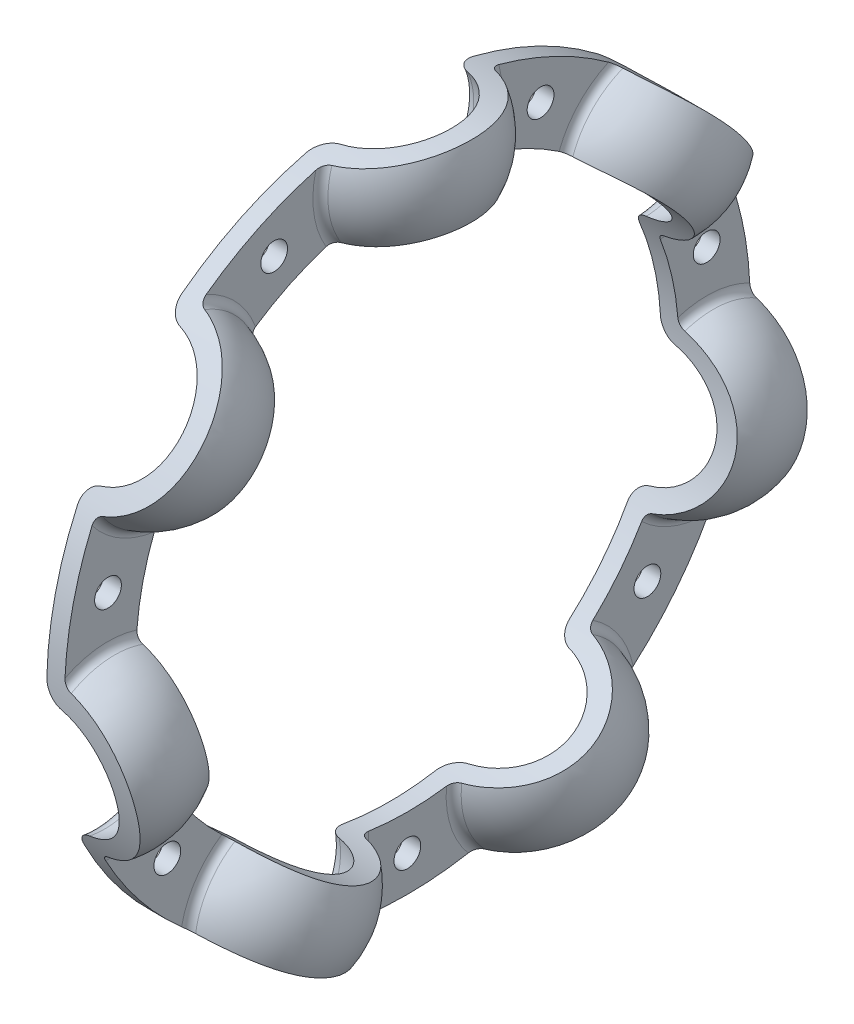
from build123d import *
from build123d.topology import SkipClean

# Parameters (mm, degrees)
SKETCH1_R                = 25
BOSS_EXTRUDE1_DEPTH      = 1
REVOLVE1_ANGLE           = 180
CUT_REVOLVE1_ANGLE       = 180
FILLET1_R                = 0.5
FILLET2_R                = 1
CIRPATTERN1_COUNT        = 7
FILLET1_OF_CIRPATTERN1_R = 0.5
FILLET2_OF_CIRPATTERN1_R = 1
CUT_EXTRUDE1_DEPTH       = 36.58089389
CUT_EXTRUDE1_DEPTH_BACK  = 36.58089389
SKETCH4_R                = 25
SKETCH4_R_2              = 19.2
CUT_EXTRUDE2_DEPTH       = 28.445947018
CUT_EXTRUDE2_DEPTH_BACK  = 28.445947018
SKETCH5_R                = 15.2
SKETCH6_R                = 0.75
CUT_EXTRUDE3_DEPTH       = 1
CIRPATTERN2_COUNT        = 7


with BuildPart() as part:
    # Sketch1 → Boss-Extrude1 (new body)
    with BuildSketch(Plane(origin=(0, 0, 0), x_dir=(0, 0, -1), z_dir=(1, 0, 0))):
        Circle(SKETCH1_R)
    extrude(amount=BOSS_EXTRUDE1_DEPTH)

    # Sketch2 → Revolve1 (revolve)
    with BuildSketch(Plane.ZY):
        with BuildLine():
            Line((-5, 17.2), (5, 17.2))
            ThreePointArc((5, 17.2), (0, 12.2), (-5, 17.2))
        make_face()
    revolve1 = revolve(axis=Axis((0, 17.2, -5), (0, 0, 1)), revolution_arc=REVOLVE1_ANGLE)

    # Sketch3 → Cut-Revolve1 (revolve, cut)
    with BuildSketch(Plane.ZY):
        with BuildLine():
            Line((-4, 17.2), (4, 17.2))
            ThreePointArc((4, 17.2), (0, 21.2), (-4, 17.2))
        make_face()
    cut_revolve1 = revolve(axis=Axis((0, 17.2, -4), (0, 0, -1)), revolution_arc=CUT_REVOLVE1_ANGLE, mode=Mode.SUBTRACT)

    # Fillet1
    fillet1_edges = [part.edges().sort_by_distance(p)[0] for p in [
        (1, 17.2, -4.898979486),
    ]]
    fillet(fillet1_edges, radius=FILLET1_R)

    # Fillet2
    fillet2_edges = [part.edges().sort_by_distance(p)[0] for p in [
        (0, 13.2, 0),
    ]]
    fillet(fillet2_edges, radius=FILLET2_R)

    # CirPattern1: Revolve1, Cut-Revolve1 ×7 about axis
    cirpattern1_axis = Axis((1, 0, 0), (1, 0, 0))
    add([revolve1.rotate(cirpattern1_axis, i * 360 / CIRPATTERN1_COUNT) for i in range(1, CIRPATTERN1_COUNT)])
    add([cut_revolve1.rotate(cirpattern1_axis, i * 360 / CIRPATTERN1_COUNT) for i in range(1, CIRPATTERN1_COUNT)], mode=Mode.SUBTRACT)

    # Fillet1 of CirPattern1
    fillet1_of_cirpattern1_edges = [part.edges().sort_by_distance(p)[0] for p in [
        (1, 14.554200986, 10.39303775),
        (1, 0.948791778, 17.85888558),
        (1, -13.371076991, 11.876628314),
        (1, -17.622252065, -3.048972312),
        (1, -8.603511906, -15.678634599),
        (1, 6.893848198, -16.501965247),
    ]]
    fillet(fillet1_of_cirpattern1_edges, radius=FILLET1_OF_CIRPATTERN1_R)

    # Fillet2 of CirPattern1
    fillet2_of_cirpattern1_edges = [part.edges().sort_by_distance(p)[0] for p in [
        (0, 8.230065385, 10.320175569),
        (0, -2.937276328, 12.869048441),
        (0, -11.892789056, 5.727265356),
        (0, -11.892789056, -5.727265356),
        (0, -2.937276328, -12.869048441),
        (0, 8.230065385, -10.320175569),
    ]]
    fillet(fillet2_of_cirpattern1_edges, radius=FILLET2_OF_CIRPATTERN1_R)

    # Sketch4 → Cut-Extrude1 (cut, two sides: drawn at the far end of the back side and taken through both)
    with SkipClean():  # the faces are left unmerged after this step: merging them gives an invalid solid
        with BuildSketch(Plane(origin=(1, 0, 0), x_dir=(0, 0, -1), z_dir=(1, 0, 0)).offset(-CUT_EXTRUDE1_DEPTH_BACK)):
            Circle(SKETCH4_R)
            Circle(SKETCH4_R_2, mode=Mode.SUBTRACT)
        extrude(amount=CUT_EXTRUDE1_DEPTH + CUT_EXTRUDE1_DEPTH_BACK, mode=Mode.SUBTRACT)

    # Sketch5 → Cut-Extrude2 (cut, two sides: drawn at the far end of the back side and taken through both)
    with BuildSketch(Plane(origin=(1, 0, 0), x_dir=(0, 0, -1), z_dir=(1, 0, 0)).offset(-CUT_EXTRUDE2_DEPTH_BACK)):
        Circle(SKETCH5_R)
    extrude(amount=CUT_EXTRUDE2_DEPTH + CUT_EXTRUDE2_DEPTH_BACK, mode=Mode.SUBTRACT)

    # Sketch6 → Cut-Extrude3 (cut)
    with BuildSketch(Plane(origin=(1, 0, 0), x_dir=(0, 0, -1), z_dir=(1, 0, 0))):
        with Locations((0, -17.2)):
            Circle(SKETCH6_R)
    cut_extrude3 = extrude(amount=-CUT_EXTRUDE3_DEPTH, mode=Mode.SUBTRACT)

    # CirPattern2: Cut-Extrude3 ×7 about axis
    cirpattern2_axis = Axis((1, 0, 0), (1, 0, 0))
    for i in range(1, CIRPATTERN2_COUNT):
        add(cut_extrude3.rotate(cirpattern2_axis, i * 360 / CIRPATTERN2_COUNT), mode=Mode.SUBTRACT)


solid = part.part
